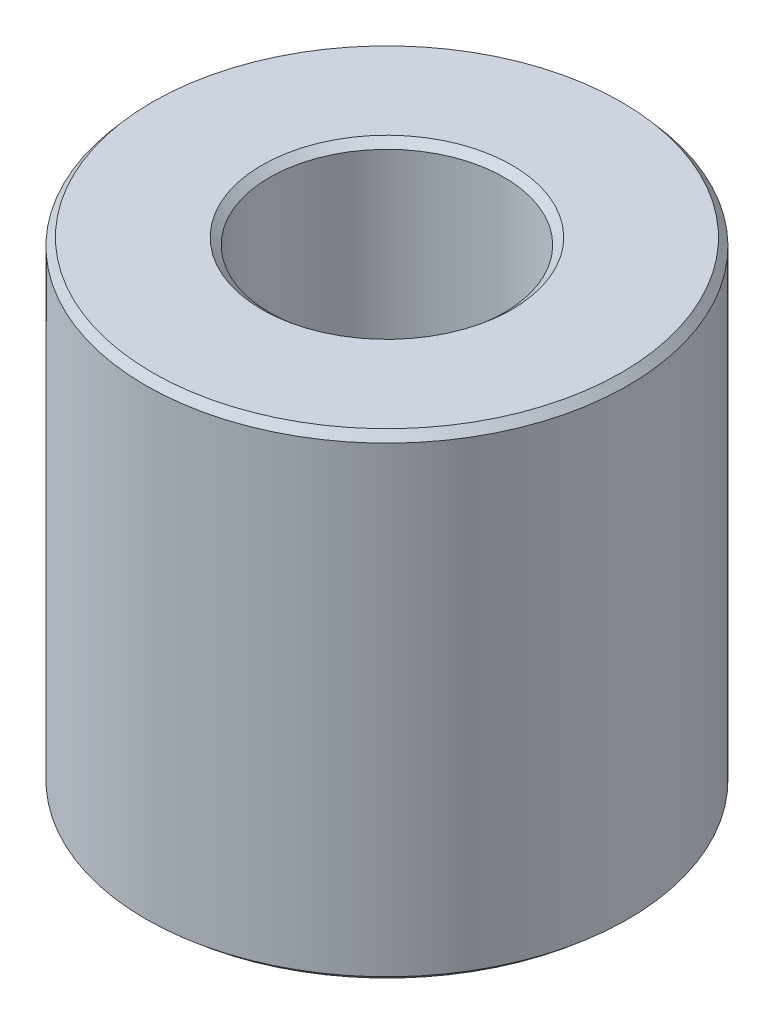
from build123d import *
from OCP.BRepFilletAPI import BRepFilletAPI_MakeChamfer

# Parameters (mm, degrees)
SKETCH1_R           = 10
BOSS_EXTRUDE1_DEPTH = 19.763920619
SKETCH2_R           = 4.861928352
CUT_EXTRUDE1_DEPTH  = 25.302521643
CHAMFER1_SIZE       = 0.323638407
CHAMFER1_SIZE2      = 0.277493904


with BuildPart() as part:
    # Sketch1 → Boss-Extrude1 (new body)
    with BuildSketch(Plane(origin=(0, 0, 0), x_dir=(1, 0, 0), z_dir=(0, 1, 0))):
        Circle(SKETCH1_R)
    extrude(amount=BOSS_EXTRUDE1_DEPTH)

    # Sketch2 → Cut-Extrude1 (cut, through all)
    with BuildSketch(Plane(origin=(0, 0, 0), x_dir=(1, 0, 0), z_dir=(0, 1, 0))):
        Circle(SKETCH2_R)
    extrude(amount=CUT_EXTRUDE1_DEPTH, mode=Mode.SUBTRACT)

    # Chamfer1: one chamfer whose edges measure the first distance from different faces: ONE call of the kernel's chamfer builder (chamfer() names one face for all edges)
    chamfer1_edges_1 = [part.edges().sort_by_distance(p)[0] for p in [
        (-4.861928352, 19.763920619, 0),
    ]]
    chamfer1_side_1 = [part.faces().sort_by_distance(p)[0] for p in [
        (-9.717157288, 19.763920619, 0),
    ]]
    chamfer1_edges_2 = [part.edges().sort_by_distance(p)[0] for p in [
        (-4.861928352, 0, 0),
    ]]
    chamfer1_side_2 = [part.faces().sort_by_distance(p)[0] for p in [
        (-4.861928352, 9.881960309, 0),
    ]]
    chamfer1_edges_3 = [part.edges().sort_by_distance(p)[0] for p in [
        (-10, 0, 0),
    ]]
    chamfer1_side_3 = [part.faces().sort_by_distance(p)[0] for p in [
        (-9.717157288, 0, 0),
    ]]
    chamfer1_edges_4 = [part.edges().sort_by_distance(p)[0] for p in [
        (-10, 19.763920619, 0),
    ]]
    chamfer1_side_4 = [part.faces().sort_by_distance(p)[0] for p in [
        (-10, 9.881960309, 0),
    ]]
    chamfer1 = BRepFilletAPI_MakeChamfer(part.part.solid().wrapped)
    for e in chamfer1_edges_1:
        chamfer1.Add(CHAMFER1_SIZE, CHAMFER1_SIZE2, e.wrapped, chamfer1_side_1[0].wrapped)  # the first distance lies on this face
    for e in chamfer1_edges_2:
        chamfer1.Add(CHAMFER1_SIZE, CHAMFER1_SIZE2, e.wrapped, chamfer1_side_2[0].wrapped)  # the first distance lies on this face
    for e in chamfer1_edges_3:
        chamfer1.Add(CHAMFER1_SIZE, CHAMFER1_SIZE2, e.wrapped, chamfer1_side_3[0].wrapped)  # the first distance lies on this face
    for e in chamfer1_edges_4:
        chamfer1.Add(CHAMFER1_SIZE, CHAMFER1_SIZE2, e.wrapped, chamfer1_side_4[0].wrapped)  # the first distance lies on this face
    add(Compound.cast(chamfer1.Shape()), mode=Mode.REPLACE)


solid = part.part
